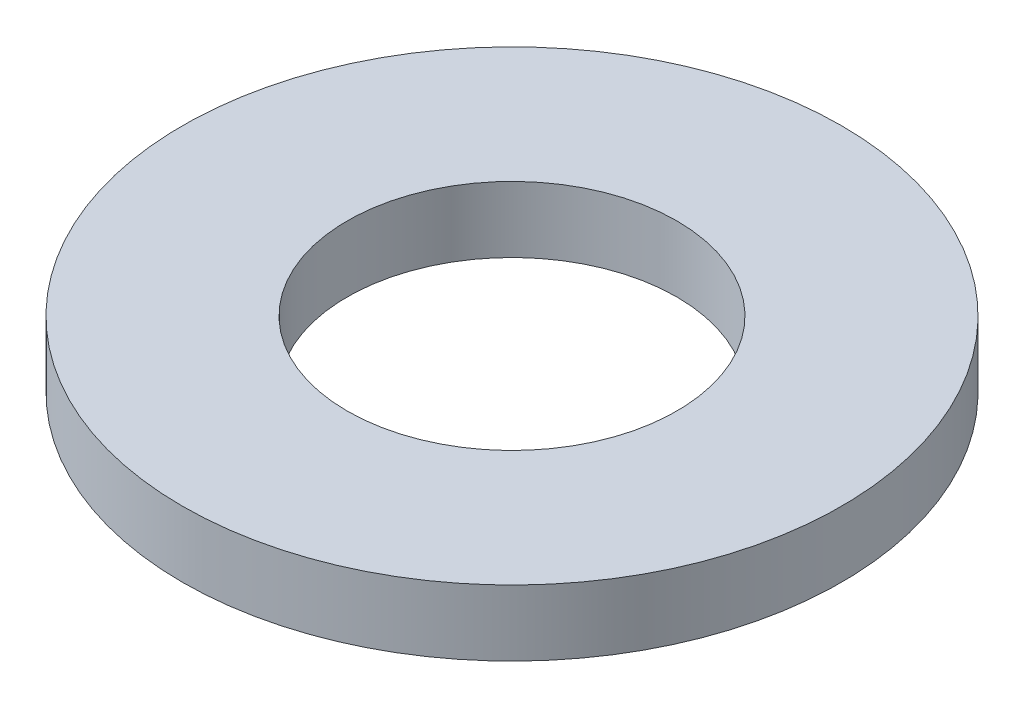
from build123d import *

# Parameters (mm, degrees)
SKETCH1_R           = 6.35
SKETCH1_R_2         = 3.175
BOSS_EXTRUDE1_DEPTH = 1.27


with BuildPart() as part:
    # Sketch1 → Boss-Extrude1 (new body)
    with BuildSketch(Plane(origin=(0, 0, 0), x_dir=(1, 0, 0), z_dir=(0, 1, 0))):
        Circle(SKETCH1_R)
        Circle(SKETCH1_R_2, mode=Mode.SUBTRACT)
    extrude(amount=BOSS_EXTRUDE1_DEPTH)


solid = part.part
